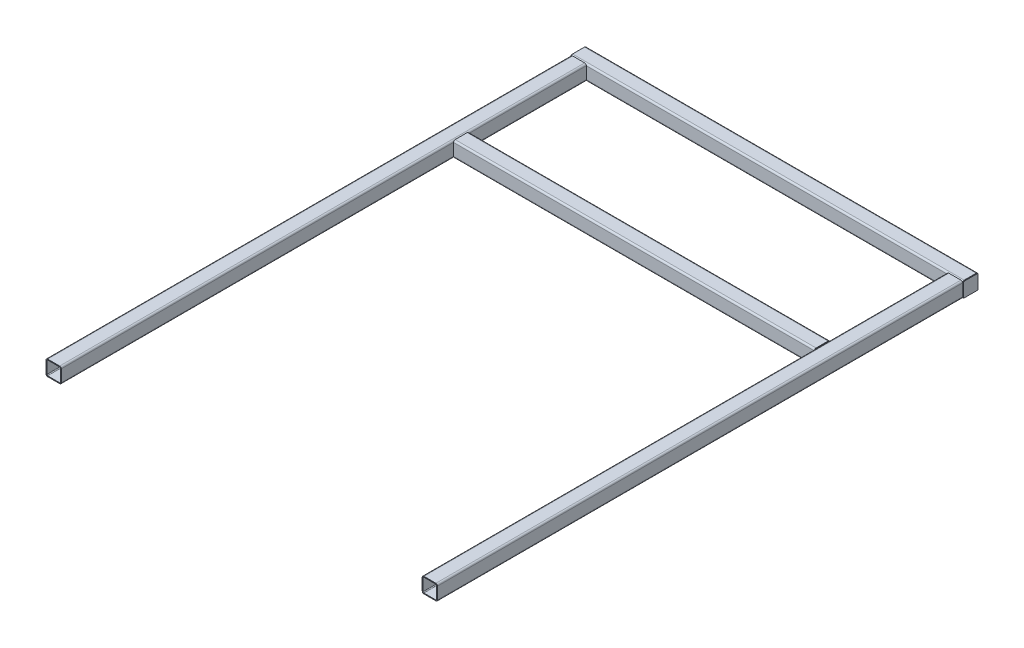
from build123d import *

# Parameters (mm, degrees)
EXTENSION_START          = -1047.75
EXTENSION_MIDDLE_DEPTH   = 2095.5
EXTENSION_START_2        = -1136.65
EXTENSION_MIDDLE_2_DEPTH = 2273.3
EXTENSION_START_3        = -5992.202181603
EXTENSION_MIDDLE_3_DEPTH = 3048
END_CAPS_WIDTH           = 84.1375
END_CAPS_HEIGHT          = 84.1375
END_CAPS_THICKNESS       = 3.175
END_CAPS_2_SIZE          = 3.175
END_CAPS_4_WIDTH         = 84.1375
END_CAPS_4_HEIGHT        = 84.1375
END_CAPS_4_THICKNESS     = 3.175
END_CAPS_5_SIZE          = 3.175


# Read off the part's stored shape, not the designer's step: extension middle
with BuildPart() as part:
    # extension middle outline → extension middle (new body)
    # profile 1 of 2: a face of its own
    with BuildSketch(Plane.YZ.offset(EXTENSION_START)):
        with BuildLine():
            ThreePointArc((250.825, -6081.102181603), (257.560192091, -6078.312373694), (260.35, -6071.577181603))
            Line((260.35, -6071.577181603), (260.35, -6001.727181603))
            ThreePointArc((260.35, -6001.727181603), (257.560192091, -5994.991989512), (250.825, -5992.202181603))
            Line((250.825, -5992.202181603), (180.975, -5992.202181603))
            ThreePointArc((180.975, -5992.202181603), (174.239807909, -5994.991989512), (171.45, -6001.727181603))
            Line((171.45, -6001.727181603), (171.45, -6071.577181603))
            ThreePointArc((171.45, -6071.577181603), (174.239807909, -6078.312373694), (180.975, -6081.102181603))
            Line((180.975, -6081.102181603), (250.825, -6081.102181603))
        make_face()
        with BuildLine():
            Line((180.975, -5996.964681603), (250.825, -5996.964681603))
            ThreePointArc((250.825, -5996.964681603), (254.192596045, -5998.359585558), (255.5875, -6001.727181603))
            Line((255.5875, -6001.727181603), (255.5875, -6071.577181603))
            ThreePointArc((255.5875, -6071.577181603), (254.192596045, -6074.944777649), (250.825, -6076.339681603))
            Line((250.825, -6076.339681603), (180.975, -6076.339681603))
            ThreePointArc((180.975, -6076.339681603), (177.607403955, -6074.944777649), (176.2125, -6071.577181603))
            Line((176.2125, -6071.577181603), (176.2125, -6001.727181603))
            ThreePointArc((176.2125, -6001.727181603), (177.607403955, -5998.359585558), (180.975, -5996.964681603))
        make_face(mode=Mode.SUBTRACT)
    # profile 2 of 2: a face of its own
    with BuildSketch(Plane.YZ.offset(EXTENSION_START)):
        with BuildLine():
            Line((180.975, -5310.034488622), (250.825, -5310.034488622))
            ThreePointArc((250.825, -5310.034488622), (257.560192091, -5307.244680713), (260.35, -5300.509488622))
            Line((260.35, -5300.509488622), (260.35, -5230.659488622))
            ThreePointArc((260.35, -5230.659488622), (257.560192091, -5223.924296531), (250.825, -5221.134488622))
            Line((250.825, -5221.134488622), (180.975, -5221.134488622))
            ThreePointArc((180.975, -5221.134488622), (174.239807909, -5223.924296531), (171.45, -5230.659488622))
            Line((171.45, -5230.659488622), (171.45, -5300.509488622))
            ThreePointArc((171.45, -5300.509488622), (174.239807909, -5307.244680713), (180.975, -5310.034488622))
        make_face()
        with BuildLine():
            ThreePointArc((176.2125, -5230.659488622), (177.607403955, -5227.291892577), (180.975, -5225.896988622))
            Line((180.975, -5225.896988622), (250.825, -5225.896988622))
            ThreePointArc((250.825, -5225.896988622), (254.192596045, -5227.291892577), (255.5875, -5230.659488622))
            Line((255.5875, -5230.659488622), (255.5875, -5300.509488622))
            ThreePointArc((255.5875, -5300.509488622), (254.192596045, -5303.877084667), (250.825, -5305.271988622))
            Line((250.825, -5305.271988622), (180.975, -5305.271988622))
            ThreePointArc((180.975, -5305.271988622), (177.607403955, -5303.877084667), (176.2125, -5300.509488622))
            Line((176.2125, -5300.509488622), (176.2125, -5230.659488622))
        make_face(mode=Mode.SUBTRACT)
    extrude(amount=EXTENSION_MIDDLE_DEPTH)

    # extension middle 2 outline → extension middle 2 (add)
    with BuildSketch(Plane.YZ.offset(EXTENSION_START_2)):
        with BuildLine():
            ThreePointArc((250.825, -6081.102181603), (257.560192091, -6078.312373694), (260.35, -6071.577181603))
            Line((260.35, -6071.577181603), (260.35, -6001.727181603))
            ThreePointArc((260.35, -6001.727181603), (257.560192091, -5994.991989512), (250.825, -5992.202181603))
            Line((250.825, -5992.202181603), (180.975, -5992.202181603))
            ThreePointArc((180.975, -5992.202181603), (174.239807909, -5994.991989512), (171.45, -6001.727181603))
            Line((171.45, -6001.727181603), (171.45, -6071.577181603))
            ThreePointArc((171.45, -6071.577181603), (174.239807909, -6078.312373694), (180.975, -6081.102181603))
            Line((180.975, -6081.102181603), (250.825, -6081.102181603))
        make_face()
        with BuildLine():
            Line((180.975, -5996.964681603), (250.825, -5996.964681603))
            ThreePointArc((250.825, -5996.964681603), (254.192596045, -5998.359585558), (255.5875, -6001.727181603))
            Line((255.5875, -6001.727181603), (255.5875, -6071.577181603))
            ThreePointArc((255.5875, -6071.577181603), (254.192596045, -6074.944777649), (250.825, -6076.339681603))
            Line((250.825, -6076.339681603), (180.975, -6076.339681603))
            ThreePointArc((180.975, -6076.339681603), (177.607403955, -6074.944777649), (176.2125, -6071.577181603))
            Line((176.2125, -6071.577181603), (176.2125, -6001.727181603))
            ThreePointArc((176.2125, -6001.727181603), (177.607403955, -5998.359585558), (180.975, -5996.964681603))
        make_face(mode=Mode.SUBTRACT)
    extrude(amount=EXTENSION_MIDDLE_2_DEPTH)


with BuildPart() as body_2:
    # extension middle 3 outline → extension middle 3 (new body)
    # profile 1 of 2: a face of its own
    with BuildSketch(Plane.XY.offset(EXTENSION_START_3)):
        with BuildLine():
            Line((1136.65, 180.975), (1136.65, 250.825))
            ThreePointArc((1136.65, 250.825), (1133.860192091, 257.560192091), (1127.125, 260.35))
            Line((1127.125, 260.35), (1057.275, 260.35))
            ThreePointArc((1057.275, 260.35), (1050.539807909, 257.560192091), (1047.75, 250.825))
            Line((1047.75, 250.825), (1047.75, 180.975))
            ThreePointArc((1047.75, 180.975), (1050.539807909, 174.239807909), (1057.275, 171.45))
            Line((1057.275, 171.45), (1127.125, 171.45))
            ThreePointArc((1127.125, 171.45), (1133.860192091, 174.239807909), (1136.65, 180.975))
        make_face()
        with BuildLine():
            ThreePointArc((1057.275, 176.2125), (1053.907403955, 177.607403955), (1052.5125, 180.975))
            Line((1052.5125, 180.975), (1052.5125, 250.825))
            ThreePointArc((1052.5125, 250.825), (1053.907403955, 254.192596045), (1057.275, 255.5875))
            Line((1057.275, 255.5875), (1127.125, 255.5875))
            ThreePointArc((1127.125, 255.5875), (1130.492596045, 254.192596045), (1131.8875, 250.825))
            Line((1131.8875, 250.825), (1131.8875, 180.975))
            ThreePointArc((1131.8875, 180.975), (1130.492596045, 177.607403955), (1127.125, 176.2125))
            Line((1127.125, 176.2125), (1057.275, 176.2125))
        make_face(mode=Mode.SUBTRACT)
    # profile 2 of 2: a face of its own
    with BuildSketch(Plane.XY.offset(EXTENSION_START_3)):
        with BuildLine():
            Line((-1047.75, 180.975), (-1047.75, 250.825))
            ThreePointArc((-1047.75, 250.825), (-1050.539807909, 257.560192091), (-1057.275, 260.35))
            Line((-1057.275, 260.35), (-1127.125, 260.35))
            ThreePointArc((-1127.125, 260.35), (-1133.860192091, 257.560192091), (-1136.65, 250.825))
            Line((-1136.65, 250.825), (-1136.65, 180.975))
            ThreePointArc((-1136.65, 180.975), (-1133.860192091, 174.239807909), (-1127.125, 171.45))
            Line((-1127.125, 171.45), (-1057.275, 171.45))
            ThreePointArc((-1057.275, 171.45), (-1050.539807909, 174.239807909), (-1047.75, 180.975))
        make_face()
        with BuildLine():
            ThreePointArc((-1127.125, 176.2125), (-1130.492596045, 177.607403955), (-1131.8875, 180.975))
            Line((-1131.8875, 180.975), (-1131.8875, 250.825))
            ThreePointArc((-1131.8875, 250.825), (-1130.492596045, 254.192596045), (-1127.125, 255.5875))
            Line((-1127.125, 255.5875), (-1057.275, 255.5875))
            ThreePointArc((-1057.275, 255.5875), (-1053.907403955, 254.192596045), (-1052.5125, 250.825))
            Line((-1052.5125, 250.825), (-1052.5125, 180.975))
            ThreePointArc((-1052.5125, 180.975), (-1053.907403955, 177.607403955), (-1057.275, 176.2125))
            Line((-1057.275, 176.2125), (-1127.125, 176.2125))
        make_face(mode=Mode.SUBTRACT)
    extrude(amount=EXTENSION_MIDDLE_3_DEPTH)


with BuildPart() as body_3:
    # end_caps: an end cap: a rectangular plate 3.175 thick over the member's open end
    with BuildSketch(Plane(origin=(1136.65, 215.9, -6036.652181603), x_dir=(0, 0, 1), z_dir=(1, 0, 0))):
        Rectangle(END_CAPS_WIDTH, END_CAPS_HEIGHT)
    extrude(amount=END_CAPS_THICKNESS)

    # end_caps 2
    end_caps_2_edges = [body_3.edges().sort_by_distance(p)[0] for p in [
        (1138.2375, 257.96875, -6078.720931603),
        (1138.2375, 173.83125, -6078.720931603),
        (1138.2375, 257.96875, -5994.583431603),
        (1138.2375, 173.83125, -5994.583431603),
    ]]
    chamfer(end_caps_2_edges, length=END_CAPS_2_SIZE)


with BuildPart() as body_4:
    # end_caps 4: an end cap: a rectangular plate 3.175 thick over the member's open end
    with BuildSketch(Plane(origin=(-1136.65, 215.9, -6036.652181603), x_dir=(0, 0, 1), z_dir=(-1, 0, 0))):
        Rectangle(END_CAPS_4_WIDTH, END_CAPS_4_HEIGHT)
    extrude(amount=END_CAPS_4_THICKNESS)

    # end_caps 5
    end_caps_5_edges = [body_4.edges().sort_by_distance(p)[0] for p in [
        (-1138.2375, 173.83125, -6078.720931603),
        (-1138.2375, 257.96875, -6078.720931603),
        (-1138.2375, 173.83125, -5994.583431603),
        (-1138.2375, 257.96875, -5994.583431603),
    ]]
    chamfer(end_caps_5_edges, length=END_CAPS_5_SIZE)


solid = Compound([part.part, body_2.part, body_3.part, body_4.part])
